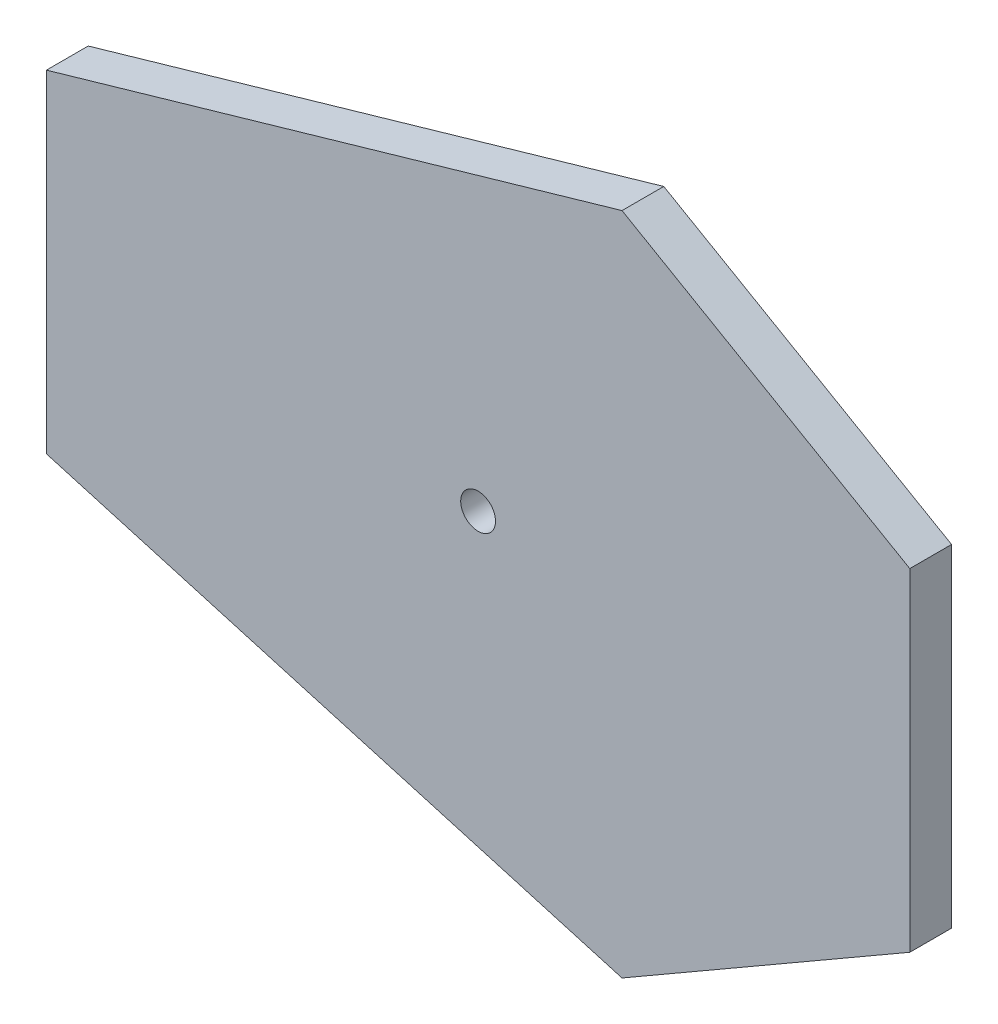
from build123d import *

# Parameters (mm, degrees)
SKETCH1_R           = 1.25
BOSS_EXTRUDE1_DEPTH = 3


with BuildPart() as part:
    # Sketch1 → Boss-Extrude1 (new body)
    with BuildSketch(Plane.XY):
        Polygon((-36.15, 11.931905563), (-36.15, -11.931905563), (5.183333333, -23.863811127), (25.85, -11.931905563), (25.85, 11.931905563), (5.183333333, 23.863811127), align=None)
        with Locations((-5.15, 0)):
            Circle(SKETCH1_R, mode=Mode.SUBTRACT)
    extrude(amount=BOSS_EXTRUDE1_DEPTH)


solid = part.part
